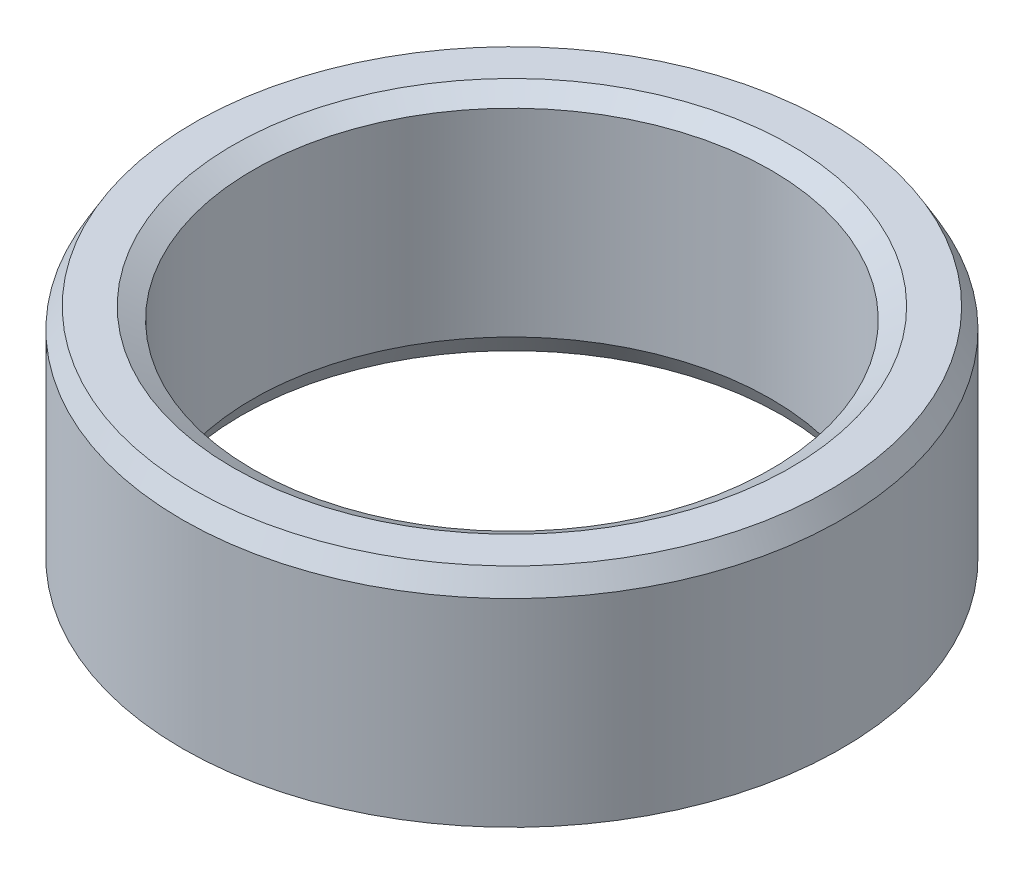
from build123d import *
from OCP.BRepFilletAPI import BRepFilletAPI_MakeChamfer

# Parameters (mm, degrees)
SKETCH1_R           = 35
BOSS_EXTRUDE1_DEPTH = 24.400008349
SKETCH2_R           = 27.511930402
CUT_EXTRUDE1_DEPTH  = 56.184784202
CHAMFER1_SIZE       = 2.130078442
CHAMFER1_SIZE2      = 1.229801362


with BuildPart() as part:
    # Sketch1 → Boss-Extrude1 (new body)
    with BuildSketch(Plane(origin=(0, 0, 0), x_dir=(1, 0, 0), z_dir=(0, 1, 0))):
        Circle(SKETCH1_R)
    extrude(amount=BOSS_EXTRUDE1_DEPTH)

    # Sketch2 → Cut-Extrude1 (cut, through all)
    with BuildSketch(Plane(origin=(0, 0, 0), x_dir=(1, 0, 0), z_dir=(0, 1, 0))):
        Circle(SKETCH2_R)
    extrude(amount=CUT_EXTRUDE1_DEPTH, mode=Mode.SUBTRACT)

    # Chamfer1: one chamfer whose edges measure the first distance from different faces: ONE call of the kernel's chamfer builder (chamfer() names one face for all edges)
    chamfer1_edges_1 = [part.edges().sort_by_distance(p)[0] for p in [
        (-27.511930402, 24.400008349, 0),
    ]]
    chamfer1_side_1 = [part.faces().sort_by_distance(p)[0] for p in [
        (-34.010050506, 24.400008349, 0),
    ]]
    chamfer1_edges_2 = [part.edges().sort_by_distance(p)[0] for p in [
        (-27.511930402, 0, 0),
    ]]
    chamfer1_side_2 = [part.faces().sort_by_distance(p)[0] for p in [
        (-27.511930402, 12.200004175, 0),
    ]]
    chamfer1_edges_3 = [part.edges().sort_by_distance(p)[0] for p in [
        (-35, 0, 0),
    ]]
    chamfer1_side_3 = [part.faces().sort_by_distance(p)[0] for p in [
        (-34.010050506, 0, 0),
    ]]
    chamfer1_edges_4 = [part.edges().sort_by_distance(p)[0] for p in [
        (-35, 24.400008349, 0),
    ]]
    chamfer1_side_4 = [part.faces().sort_by_distance(p)[0] for p in [
        (-35, 12.200004175, 0),
    ]]
    chamfer1 = BRepFilletAPI_MakeChamfer(part.part.solid().wrapped)
    for e in chamfer1_edges_1:
        chamfer1.Add(CHAMFER1_SIZE, CHAMFER1_SIZE2, e.wrapped, chamfer1_side_1[0].wrapped)  # the first distance lies on this face
    for e in chamfer1_edges_2:
        chamfer1.Add(CHAMFER1_SIZE, CHAMFER1_SIZE2, e.wrapped, chamfer1_side_2[0].wrapped)  # the first distance lies on this face
    for e in chamfer1_edges_3:
        chamfer1.Add(CHAMFER1_SIZE, CHAMFER1_SIZE2, e.wrapped, chamfer1_side_3[0].wrapped)  # the first distance lies on this face
    for e in chamfer1_edges_4:
        chamfer1.Add(CHAMFER1_SIZE, CHAMFER1_SIZE2, e.wrapped, chamfer1_side_4[0].wrapped)  # the first distance lies on this face
    add(Compound.cast(chamfer1.Shape()), mode=Mode.REPLACE)


solid = part.part
